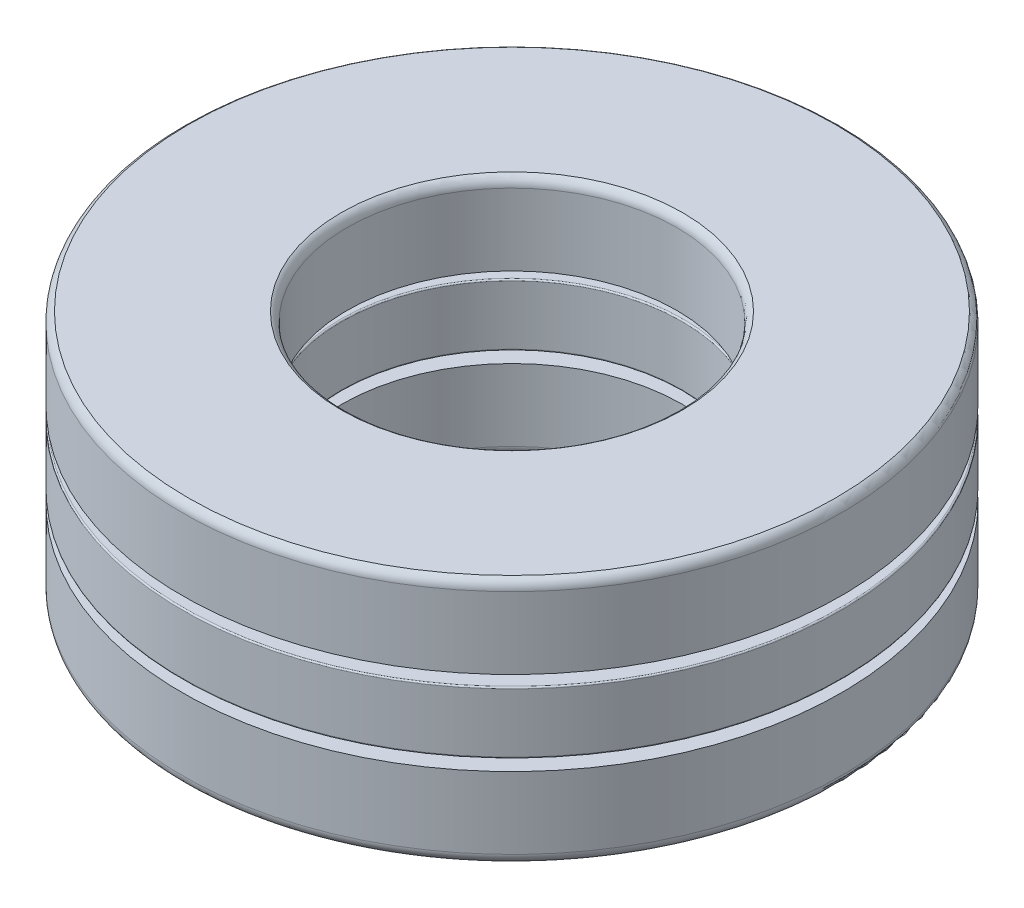
from build123d import *

# Parameters (mm, degrees)
CIRPATTERN1_COUNT = 9
CIRPATTERN2_COUNT = 9


# Read off the part's stored shape, not the designer's step: Cut-Revolve1
with BuildPart() as part:
    # Sketch3 → Revolve1 (revolve)
    with BuildSketch(Plane(origin=(0, 0, 0), x_dir=(0, 0, -1), z_dir=(1, 0, 0))):
        with BuildLine():
            Line((6, 0.765), (5.32293677, 0.765))
            ThreePointArc((5.32293677, 0.765), (4.55, 1.0875), (3.77706323, 0.765))
            Line((3.77706323, 0.765), (3, 0.765))
            Line((3, 0.765), (3, 2.071394289))
            ThreePointArc((3, 2.071394289), (3.029706136, 2.176275174), (3.11, 2.25))
            Line((3.11, 2.25), (5.89, 2.25))
            ThreePointArc((5.89, 2.25), (5.970293864, 2.176275174), (6, 2.071394289))
            Line((6, 2.071394289), (6, 0.765))
        make_face()
        with BuildLine():
            Line((3.77706323, -0.765), (3.1, -0.765))
            Line((3.1, -0.765), (3.1, -2.071394289))
            ThreePointArc((3.1, -2.071394289), (3.129706136, -2.176275174), (3.21, -2.25))
            Line((3.21, -2.25), (5.89, -2.25))
            ThreePointArc((5.89, -2.25), (5.970293864, -2.176275174), (6, -2.071394289))
            Line((6, -2.071394289), (6, -0.765))
            Line((6, -0.765), (5.32293677, -0.765))
            ThreePointArc((5.32293677, -0.765), (4.55, -1.0875), (3.77706323, -0.765))
        make_face()
        with BuildLine():
            Line((5.975, 0.5625), (3.125, 0.5625))
            ThreePointArc((3.125, 0.5625), (3.10732233, 0.55517767), (3.1, 0.5375))
            Line((3.1, 0.5375), (3.1, -0.5375))
            ThreePointArc((3.1, -0.5375), (3.10732233, -0.55517767), (3.125, -0.5625))
            Line((3.125, -0.5625), (5.975, -0.5625))
            ThreePointArc((5.975, -0.5625), (5.99267767, -0.55517767), (6, -0.5375))
            Line((6, -0.5375), (6, 0.5375))
            ThreePointArc((6, 0.5375), (5.99267767, 0.55517767), (5.975, 0.5625))
        make_face()
    revolve(axis=Axis((0, -2.25, 0), (0, 1, 0)))

    # Cut-Revolve1 outline → Cut-Revolve1 (revolve, cut)
    with BuildSketch(Plane.XY.offset(-4.55)):
        with BuildLine():
            Line((0.99371639, 0.562500001), (0, 0.562500001))
            Line((0, 0.562500001), (0, -0.562500001))
            Line((0, -0.562500001), (0.99371639, -0.562500001))
            ThreePointArc((0.99371639, -0.562500001), (1.141875, 0), (0.99371639, 0.562500001))
        make_face()
    cut_revolve1 = revolve(axis=Axis((0, 0, -4.55), (0, 1, 0)), mode=Mode.SUBTRACT)

    # CirPattern2: Cut-Revolve1 ×9 about axis
    cirpattern2_axis = Axis((0, 0, 0), (0, 1, 0))
    for i in range(1, CIRPATTERN2_COUNT):
        add(cut_revolve1.rotate(cirpattern2_axis, i * 360 / CIRPATTERN2_COUNT), mode=Mode.SUBTRACT)


with BuildPart() as body_2:
    # Sketch4 → Revolve2 (revolve)
    with BuildSketch(Plane(origin=(0, 0, 0), x_dir=(0, 0, -1), z_dir=(1, 0, 0))):
        with BuildLine():
            Line((4.55, -1.0875), (4.55, 1.0875))
            ThreePointArc((4.55, 1.0875), (3.4625, 0), (4.55, -1.0875))
        make_face()
    revolve(axis=Axis((0, 2.25, -4.55), (0, -1, 0)))


with BuildPart() as cirpattern1_1:
    # CirPattern1: pattern copy
    add(body_2.part.rotate(Axis((0, 0, 0), (0, 1, 0)), 1 * 360 / CIRPATTERN1_COUNT))


with BuildPart() as cirpattern1_2:
    # CirPattern1: pattern copy
    add(body_2.part.rotate(Axis((0, 0, 0), (0, 1, 0)), 2 * 360 / CIRPATTERN1_COUNT))


with BuildPart() as cirpattern1_3:
    # CirPattern1: pattern copy
    add(body_2.part.rotate(Axis((0, 0, 0), (0, 1, 0)), 3 * 360 / CIRPATTERN1_COUNT))


with BuildPart() as cirpattern1_4:
    # CirPattern1: pattern copy
    add(body_2.part.rotate(Axis((0, 0, 0), (0, 1, 0)), 4 * 360 / CIRPATTERN1_COUNT))


with BuildPart() as cirpattern1_5:
    # CirPattern1: pattern copy
    add(body_2.part.rotate(Axis((0, 0, 0), (0, 1, 0)), 5 * 360 / CIRPATTERN1_COUNT))


with BuildPart() as cirpattern1_6:
    # CirPattern1: pattern copy
    add(body_2.part.rotate(Axis((0, 0, 0), (0, 1, 0)), 6 * 360 / CIRPATTERN1_COUNT))


with BuildPart() as cirpattern1_7:
    # CirPattern1: pattern copy
    add(body_2.part.rotate(Axis((0, 0, 0), (0, 1, 0)), 7 * 360 / CIRPATTERN1_COUNT))


with BuildPart() as cirpattern1_8:
    # CirPattern1: pattern copy
    add(body_2.part.rotate(Axis((0, 0, 0), (0, 1, 0)), 8 * 360 / CIRPATTERN1_COUNT))


solid = Compound([part.part, body_2.part, cirpattern1_1.part, cirpattern1_2.part, cirpattern1_3.part, cirpattern1_4.part, cirpattern1_5.part, cirpattern1_6.part, cirpattern1_7.part, cirpattern1_8.part])
